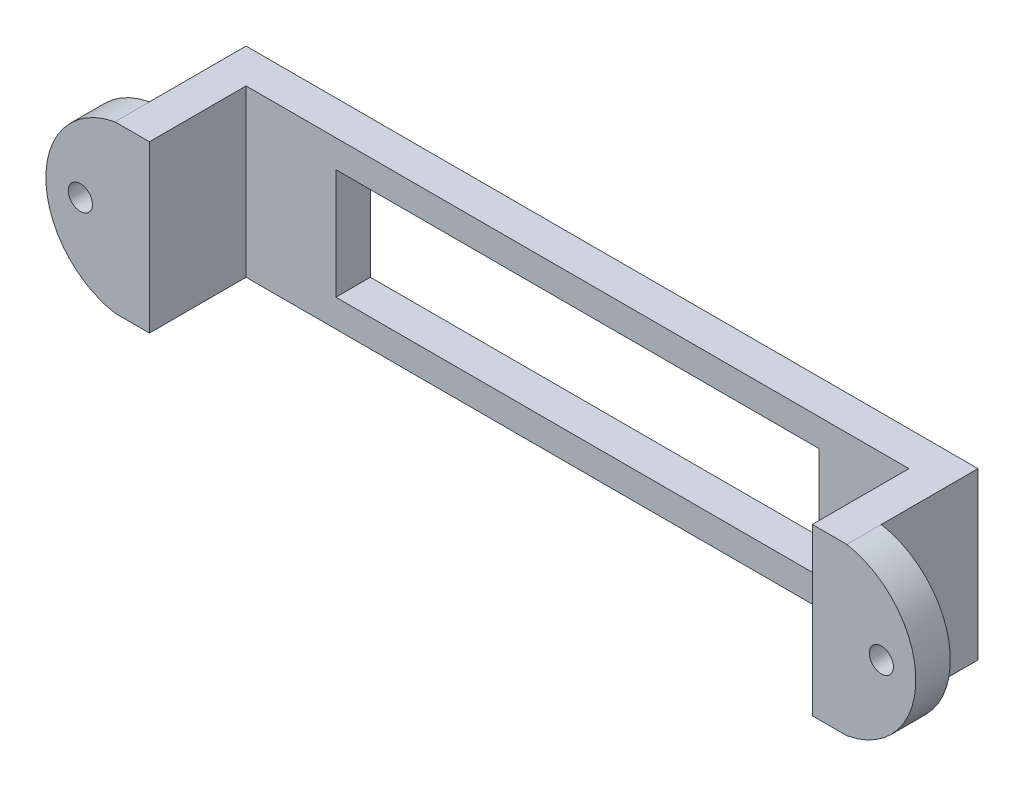
from build123d import *

# Parameters (mm, degrees)
ESQUISSE1_W             = 106
ESQUISSE1_H             = 24
ESQUISSE1_W_2           = 70
ESQUISSE1_H_2           = 16
BOSS_EXTRU_1_DEPTH      = 5
ESQUISSE2_W             = 5
ESQUISSE2_H             = 24
BOSS_EXTRU_2_DEPTH      = 9
BOSS_EXTRU_3_DEPTH      = 5
ESQUISSE4_R             = 1.75
ENL_V_MAT_EXTRU_2_DEPTH = 67.887966033


with BuildPart() as part:
    # Esquisse1 → Boss.-Extru.1 (new body)
    with BuildSketch(Plane.XY):
        Rectangle(ESQUISSE1_W, ESQUISSE1_H)
        Rectangle(ESQUISSE1_W_2, ESQUISSE1_H_2, mode=Mode.SUBTRACT)
    extrude(amount=BOSS_EXTRU_1_DEPTH)

    # Esquisse2 → Boss.-Extru.2 (add)
    with BuildSketch(Plane.XY.offset(5)):
        with Locations((-50.5, 0)):
            Rectangle(ESQUISSE2_W, ESQUISSE2_H)
        with Locations((50.5, 0)):
            Rectangle(ESQUISSE2_W, ESQUISSE2_H)
    extrude(amount=BOSS_EXTRU_2_DEPTH)

    # Esquisse3 → Boss.-Extru.3 (add)
    with BuildSketch(Plane.XY.offset(14)):
        with BuildLine():
            Line((-48, 12), (-53, 12))
            ThreePointArc((-53, 12), (-63, 0), (-53, -12))
            Line((-53, -12), (-48, -12))
            Line((-48, -12), (-48, 12))
        make_face()
        with BuildLine():
            Line((48, -12), (53, -12))
            ThreePointArc((53, -12), (63, 0), (53, 12))
            Line((53, 12), (48, 12))
            Line((48, 12), (48, -12))
        make_face()
    extrude(amount=BOSS_EXTRU_3_DEPTH)

    # Esquisse4 → Enlèv. mat.-Extru.2 (cut, through all)
    with BuildSketch(Plane.XY.offset(19)):
        with Locations((-58, 0)):
            Circle(ESQUISSE4_R)
        with Locations((58, 0)):
            Circle(ESQUISSE4_R)
    extrude(amount=-ENL_V_MAT_EXTRU_2_DEPTH, mode=Mode.SUBTRACT)


solid = part.part
